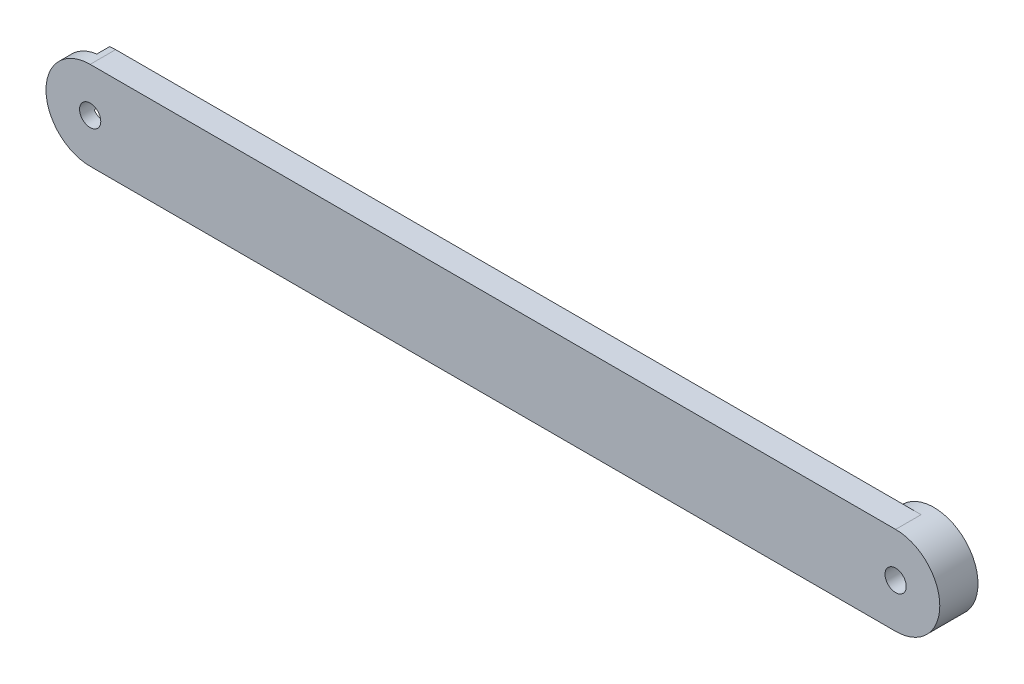
from build123d import *

# Parameters (mm, degrees)
SKETCH1_R           = 2.5
BOSS_EXTRUDE1_DEPTH = 6
CUT_EXTRUDE3_DEPTH  = 3
BOSS_EXTRUDE2_START = 3
SKETCH4_R           = 2.5
BOSS_EXTRUDE2_DEPTH = 3


with BuildPart() as part:
    # Sketch1 → Boss-Extrude1 (new body)
    with BuildSketch(Plane.XY):
        with BuildLine():
            Line((0, -10.4), (189.7, -10.4))
            ThreePointArc((189.7, -10.4), (200.1, 0), (189.7, 10.4))
            Line((189.7, 10.4), (0, 10.4))
            ThreePointArc((0, 10.4), (-10.4, 0), (0, -10.4))
        make_face()
        Circle(SKETCH1_R, mode=Mode.SUBTRACT)
        with Locations((189.7, 0)):
            Circle(SKETCH1_R, mode=Mode.SUBTRACT)
    extrude(amount=BOSS_EXTRUDE1_DEPTH)

    # Sketch6 → Cut-Extrude3 (cut)
    with BuildSketch(Plane(origin=(0, 0, 0), x_dir=(-1, 0, 0), z_dir=(0, 0, -1))):
        with BuildLine():
            ThreePointArc((0.189684667, 2.492793559), (1.571265552, 1.944511395), (2.39740304, 0.708843186))
            Line((2.39740304, 0.708843186), (9.775402468, 3.549860079))
            ThreePointArc((9.775402468, 3.549860079), (6.536464696, 8.089167403), (1.418291579, 10.302836939))
            Line((1.418291579, 10.302836939), (0.189684667, 2.492793559))
        make_face()
        with BuildLine():
            ThreePointArc((0, -10.4), (4.572262674, -9.341007121), (8.213372731, -6.379695007))
            Line((8.213372731, -6.379695007), (2.063980215, -1.41066852))
            ThreePointArc((2.063980215, -1.41066852), (0.89836349, -2.333011582), (-0.584825314, -2.430633529))
            Line((-0.584825314, -2.430633529), (-1.838495524, -10.4))
            Line((-1.838495524, -10.4), (0, -10.4))
        make_face()
        with BuildLine():
            ThreePointArc((-2.253664882, -1.082125039), (-2.469629042, 0.388500187), (-1.812577726, 1.721790343))
            Line((-1.812577726, 1.721790343), (-8.117559384, 6.816540886))
            ThreePointArc((-8.117559384, 6.816540886), (-10.471227138, 1.647240791), (-9.818339107, -3.995024054))
            Line((-9.818339107, -3.995024054), (-2.253664882, -1.082125039))
        make_face()
    extrude(amount=-CUT_EXTRUDE3_DEPTH, mode=Mode.SUBTRACT)

    # Sketch4 → Boss-Extrude2 (add)
    with BuildSketch(Plane(origin=(0, 0, 0), x_dir=(-1, 0, 0), z_dir=(0, 0, -1)).offset(BOSS_EXTRUDE2_START)):
        with BuildLine():
            ThreePointArc((-189.7, 10.4), (-200.1, 0), (-189.7, -10.4))
            ThreePointArc((-189.7, -10.4), (-179.3, 0), (-189.7, 10.4))
        make_face()
        with Locations((-189.7, 0)):
            Circle(SKETCH4_R, mode=Mode.SUBTRACT)
    extrude(amount=-BOSS_EXTRUDE2_DEPTH)


solid = part.part
